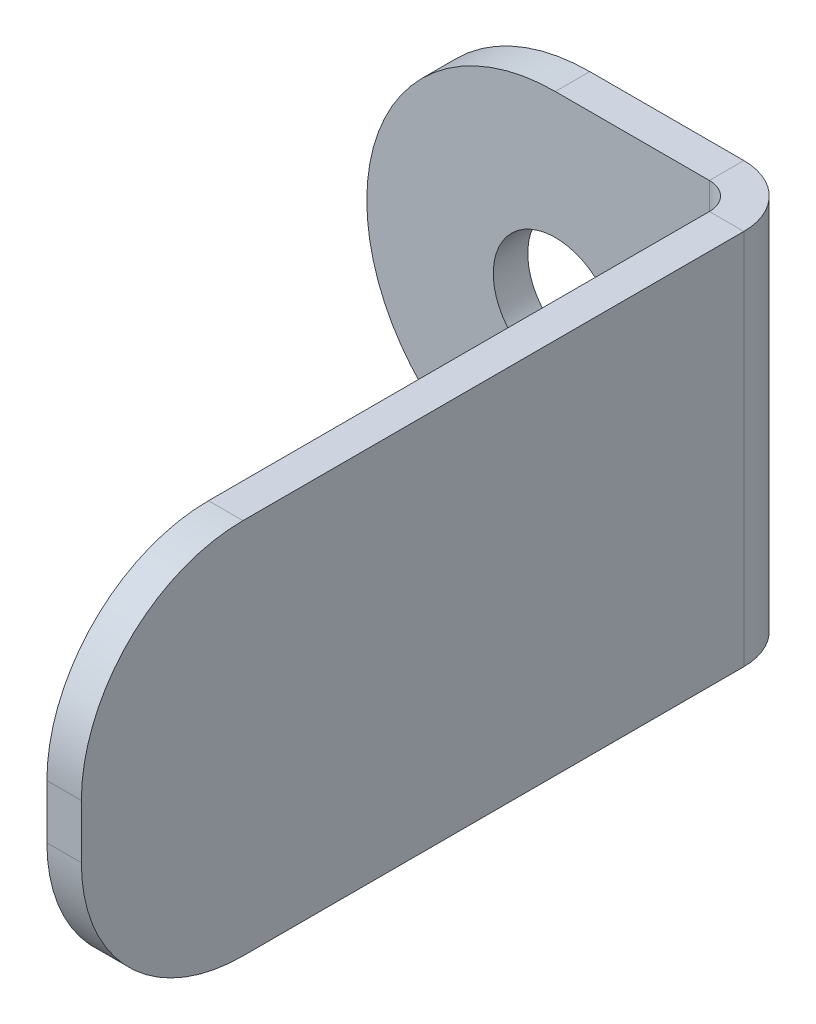
from build123d import *

# Parameters (mm, degrees)
SKETCH1_R                    = 1.8288
BASE_FLANGE1_DEPTH           = 1.016
EDGE_FLANGE1_STRIP_W         = 5.6515
EDGE_FLANGE1_STRIP_H         = 1.016
EDGE_FLANGE1_STRIP_CUT_DEPTH = 11.1125
EDGE_FLANGE1_DEPTH           = 11.1125
FILLET1_R                    = 4.7625


# Sheet-metal steps are written as plain solids
with BuildPart() as part:
    # Sketch1 → Base-Flange1 (new body)
    with BuildSketch(Plane.XY):
        with BuildLine():
            Line((-12.7, 65.88125), (-6.35, 65.88125))
            Line((-6.35, 65.88125), (-6.35, 54.76875))
            Line((-6.35, 54.76875), (-12.7, 54.76875))
            ThreePointArc((-12.7, 54.76875), (-18.25625, 60.325), (-12.7, 65.88125))
        make_face()
        with Locations((-12.7, 60.325)):
            Circle(SKETCH1_R, mode=Mode.SUBTRACT)
    extrude(amount=BASE_FLANGE1_DEPTH)

    # Edge-Flange1 strip (across the edge) → Edge-Flange1 strip cut (cut)
    with BuildSketch(Plane(origin=(-6.35, 54.76875, 1.016), x_dir=(-1, 0, 0), z_dir=(0, 1, 0))):
        with Locations((-1.016, -0.508)):
            Rectangle(EDGE_FLANGE1_STRIP_W, EDGE_FLANGE1_STRIP_H)
    extrude(amount=EDGE_FLANGE1_STRIP_CUT_DEPTH, mode=Mode.SUBTRACT)

    # Edge-Flange1 section (across the edge) → Edge-Flange1 (add)
    with BuildSketch(Plane(origin=(-6.35, 54.76875, 1.016), x_dir=(-1, 0, 0), z_dir=(0, 1, 0))):
        with BuildLine():
            Line((0, 0.79375), (0, 20.32))
            Line((0, 20.32), (1.016, 20.32))
            Line((1.016, 20.32), (1.016, 0.79375))
            ThreePointArc((1.016, 0.79375), (1.248483992, 0.232483992), (1.80975, 0))
            Line((1.80975, 0), (1.80975, -1.016))
            ThreePointArc((1.80975, -1.016), (0.530063503, -0.485936497), (0, 0.79375))
        make_face()
    extrude(amount=EDGE_FLANGE1_DEPTH)

    # Fillet1
    fillet1_edges = [part.edges().sort_by_distance(p)[0] for p in [
        (-6.858, 54.76875, 21.336),
        (-6.858, 65.88125, 21.336),
    ]]
    fillet(fillet1_edges, radius=FILLET1_R)


solid = part.part
